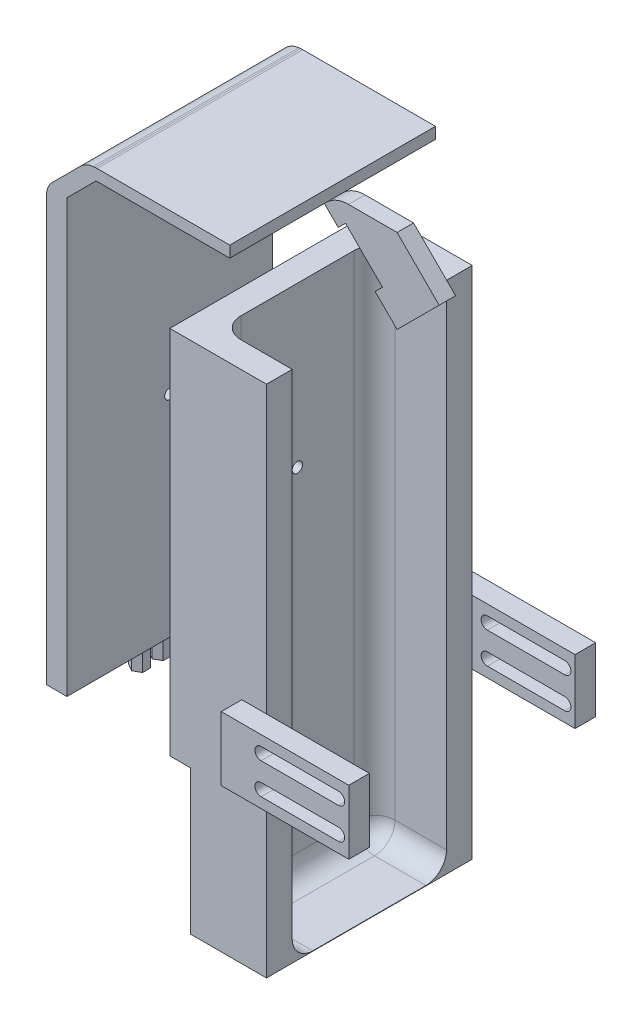
from build123d import *

# Parameters (mm, degrees)
SKETCH1_W                 = 25
SKETCH1_H                 = 100
BOSS_EXTRUDE1_DEPTH       = 250
BOSS_EXTRUDE2_DEPTH       = 30
BOSS_EXTRUDE2_DEPTH_BACK  = 250
SKETCH5_W                 = 10
SKETCH5_H                 = 100
SKETCH6_R                 = 2.5
CUT_EXTRUDE1_DEPTH        = 250
SKETCH7_W                 = 100
SKETCH7_H                 = 7.071067811
BOSS_EXTRUDE3_DEPTH       = 20
LOFT1_START               = -240.416305603
LOFT1_OUTLINE_W           = 27.071067812
LOFT1_OUTLINE_H           = 100
LOFT1_DEPTH               = 7.071067811
FILLET1_R                 = 10
SKETCH8_W                 = 100
SKETCH8_H                 = 5.5
BOSS_EXTRUDE4_DEPTH       = 65
LOFT2_START               = -301.723059561
LOFT2_OUTLINE_W           = 5.02493781
LOFT2_OUTLINE_H           = 100
LOFT2_DEPTH               = 5.472704546
FILLET2_R                 = 10
SKETCH9_W                 = 8
SKETCH9_H                 = 3.889087297
BOSS_EXTRUDE5_DEPTH       = 50
SKETCH12_W                = 8
SKETCH12_H                = 25
BOSS_EXTRUDE7_DEPTH       = 50
SKETCH11_W                = 25.4
SKETCH11_H                = 25.4
CUT_EXTRUDE4_DEPTH        = 5
CUT_EXTRUDE6_DEPTH        = 80
CUT_EXTRUDE6_DEPTH_BACK   = 10
SKETCH14_W                = 8
SKETCH14_H                = 14.927669529
SKETCH15_W                = 22
SKETCH15_H                = 250
BOSS_EXTRUDE8_DEPTH       = 100
SKETCH16_W                = 75
SKETCH16_H                = 250
CUT_EXTRUDE7_DEPTH        = 35
FILLET4_R                 = 10
SKETCH18_W                = 35
SKETCH18_H                = 0.2
BOSS_EXTRUDE10_DEPTH      = 75
FILLET5_R                 = 10
FILLET6_R                 = 15
BOSS_EXTRUDE11_DEPTH      = 10
BOSS_EXTRUDE11_DEPTH_BACK = 110
CUT_EXTRUDE8_DEPTH        = 100
SKETCH21_W                = 10
SKETCH21_H                = 70
CUT_EXTRUDE9_DEPTH        = 100
BOSS_EXTRUDE12_DEPTH      = 10
SKETCH24_W                = 10
SKETCH24_H                = 70
CUT_EXTRUDE10_DEPTH       = 100
BOSS_EXTRUDE13_DEPTH      = 10
SKETCH26_W                = 10
SKETCH26_H                = 34.88136448
SKETCH26_H_2              = 34.684301237
CUT_EXTRUDE11_DEPTH       = 10


with BuildPart() as part:
    # Sketch1 → Boss-Extrude1 (new body)
    with BuildSketch(Plane(origin=(0, 0, 0), x_dir=(1, 0, 0), z_dir=(0, 1, 0))):
        with Locations((12.5, 50)):
            Rectangle(SKETCH1_W, SKETCH1_H)
    extrude(amount=BOSS_EXTRUDE1_DEPTH)


with BuildPart() as body_2:
    # Sketch5 → Boss-Extrude2 (new, two sides: drawn at the far end of the back side and taken through both)
    with BuildSketch(Plane(origin=(0, 250, 0), x_dir=(1, 0, 0), z_dir=(0, 1, 0)).offset(-BOSS_EXTRUDE2_DEPTH_BACK)):
        with Locations((-55, 50)):
            Rectangle(SKETCH5_W, SKETCH5_H)
    extrude(amount=BOSS_EXTRUDE2_DEPTH + BOSS_EXTRUDE2_DEPTH_BACK)


with BuildPart() as cut_extrude1_tool:
    # Sketch6 → Cut-Extrude1 (new body)
    with BuildSketch(Plane.ZY.offset(60)):
        with Locations((-50, 172.5)):
            Circle(SKETCH6_R)
    extrude(amount=-CUT_EXTRUDE1_DEPTH)


with BuildPart() as part_1:
    add(part.part)

    # Cut-Extrude1: cut by cut_extrude1_tool
    add(cut_extrude1_tool.part, mode=Mode.SUBTRACT)

    # Sketch15 → Boss-Extrude8 (add)
    with BuildSketch(Plane.XY):
        with Locations((36, 125)):
            Rectangle(SKETCH15_W, SKETCH15_H)
    extrude(amount=-BOSS_EXTRUDE8_DEPTH)

    # Sketch16 → Cut-Extrude7 (cut)
    with BuildSketch(Plane(origin=(47, 0, 0), x_dir=(0, 0, -1), z_dir=(1, 0, 0))):
        with Locations((50, 125)):
            Rectangle(SKETCH16_W, SKETCH16_H)
    extrude(amount=-CUT_EXTRUDE7_DEPTH, mode=Mode.SUBTRACT)

    # Fillet4
    fillet4_edges = [part_1.edges().sort_by_distance(p)[0] for p in [
        (12, 125, -87.5),
        (12, 125, -12.5),
    ]]
    fillet(fillet4_edges, radius=FILLET4_R)

    # Sketch18 → Boss-Extrude10 (add)
    with BuildSketch(Plane.XY.offset(-87.5)):
        with Locations((29.5, 0.1)):
            Rectangle(SKETCH18_W, SKETCH18_H)
    extrude(amount=BOSS_EXTRUDE10_DEPTH)

    # Fillet5
    fillet5_edges = [part_1.edges().sort_by_distance(p)[0] for p in [
        (14.928932188, 0.2, -15.428932188),
        (34.5, 0.2, -87.5),
        (14.928932188, 0.2, -84.571067812),
        (12, 0.2, -50),
        (34.5, 0.2, -12.5),
    ]]
    fillet(fillet5_edges, radius=FILLET5_R)

    # Sketch19 → Boss-Extrude11 (add, two sides: drawn at the far end of the back side and taken through both)
    with BuildSketch(Plane.XY.offset(-BOSS_EXTRUDE11_DEPTH_BACK)):
        Polygon((35, 80), (47, 80), (97, 80), (97, 111.16), (47, 111.16), (35, 111.16), align=None)
        with BuildLine():
            ThreePointArc((54.357607687, 85), (51.357607687, 88), (54.357607687, 91))
            Line((54.357607687, 91), (92, 91))
            ThreePointArc((92, 91), (95, 88), (92, 85))
            Line((92, 85), (54.357607687, 85))
        make_face(mode=Mode.SUBTRACT)
        with BuildLine():
            Line((54.357607687, 106.16), (92, 106.16))
            ThreePointArc((92, 106.16), (95, 103.16), (92, 100.16))
            Line((92, 100.16), (54.357607687, 100.16))
            ThreePointArc((54.357607687, 100.16), (51.357607687, 103.16), (54.357607687, 106.16))
        make_face(mode=Mode.SUBTRACT)
    extrude(amount=BOSS_EXTRUDE11_DEPTH + BOSS_EXTRUDE11_DEPTH_BACK)

    # Sketch20 → Cut-Extrude8 (cut)
    with BuildSketch(Plane(origin=(0, 111.16, 0), x_dir=(1, 0, 0), z_dir=(0, 1, 0))):
        Polygon((47, 100), (97, 100), (97, 0), (47, 0), (47, 12.5), (34.5, 12.5), (34.5, 87.5), (47, 87.5), align=None)
    extrude(amount=-CUT_EXTRUDE8_DEPTH, mode=Mode.SUBTRACT)

    # Sketch21 → Cut-Extrude9 (cut)
    with BuildSketch(Plane.XY):
        with Locations((5, 35)):
            Rectangle(SKETCH21_W, SKETCH21_H)
    extrude(amount=-CUT_EXTRUDE9_DEPTH, mode=Mode.SUBTRACT)

    # Sketch23 → Boss-Extrude12 (add)
    with BuildSketch(Plane.XZ.offset(-70)):
        Polygon((4.999999926, -13.46370306), (7.999999853, -11.731652295), (7.999999853, -8.267550765), (4.999999926, -6.5355), (2, -8.267550765), (2, -11.731652295), align=None)
        Polygon((4.999999926, -16.5355), (2, -18.267550765), (2, -21.731652295), (4.999999926, -23.46370306), (7.999999853, -21.731652295), (7.999999853, -18.267550765), align=None)
        Polygon((4.999999926, -26.5355), (2, -28.267550765), (2, -31.731652295), (4.999999926, -33.46370306), (7.999999853, -31.731652295), (7.999999853, -28.267550765), align=None)
        Polygon((4.999999926, -36.5355), (2, -38.267550765), (2, -41.731652295), (4.999999926, -43.46370306), (7.999999853, -41.731652295), (7.999999853, -38.267550765), align=None)
        Polygon((4.999999926, -46.5355), (2, -48.267550765), (2, -51.731652295), (4.999999926, -53.46370306), (7.999999853, -51.731652295), (7.999999853, -48.267550765), align=None)
        Polygon((4.999999926, -56.5355), (2, -58.267550765), (2, -61.731652295), (4.999999926, -63.46370306), (7.999999853, -61.731652295), (7.999999853, -58.267550765), align=None)
        Polygon((4.999999926, -66.5355), (2, -68.267550765), (2, -71.731652295), (4.999999926, -73.46370306), (7.999999853, -71.731652295), (7.999999853, -68.267550765), align=None)
        Polygon((4.999999926, -76.5355), (2, -78.267550765), (2, -81.731652295), (4.999999926, -83.46370306), (7.999999853, -81.731652295), (7.999999853, -78.267550765), align=None)
        Polygon((4.999999926, -86.5355), (2, -88.267550765), (2, -91.731652295), (4.999999926, -93.46370306), (7.999999853, -91.731652295), (7.999999853, -88.267550765), align=None)
    extrude(amount=BOSS_EXTRUDE12_DEPTH)


with BuildPart() as body_2_1:
    add(body_2.part)

    # Cut-Extrude1: cut by cut_extrude1_tool
    add(cut_extrude1_tool.part, mode=Mode.SUBTRACT)



with BuildPart() as body_3:
    # Sketch7 → Boss-Extrude3 (new body)
    with BuildSketch(Plane(origin=(115, 115, 0), x_dir=(0, 0, -1), z_dir=(0.7071067811865464, 0.7071067811865488, 0))):
        with Locations((50, 236.880771697)):
            Rectangle(SKETCH7_W, SKETCH7_H)
    extrude(amount=BOSS_EXTRUDE3_DEPTH)


with BuildPart() as body_2_2:
    add(body_2_1.part)

    add(body_3.part)  # Loft1 merges body 3
    # Loft1: read off the stored shape, not the designer's step
    # Loft1 outline → Loft1 (add)
    with BuildSketch(Plane(origin=(0, 0, 0), x_dir=(0.707106781186545, 0.70710678118655, 0), z_dir=(0.70710678118655, -0.707106781186545, 0)).offset(LOFT1_START)):
        with Locations((169.099025767, -50)):
            Rectangle(LOFT1_OUTLINE_W, LOFT1_OUTLINE_H)
    extrude(amount=LOFT1_DEPTH)

    # Fillet1
    fillet1_edges = [body_2_2.edges().sort_by_distance(p)[0] for p in [
        (-60, 280, -50),
    ]]
    fillet(fillet1_edges, radius=FILLET1_R)



with BuildPart() as body_3_2:
    # Sketch8 → Boss-Extrude4 (new body)
    with BuildSketch(Plane(origin=(-35.857864376, 0, 0), x_dir=(0, 0, -1), z_dir=(1, 0, 0))):
        with Locations((50, 296.892135624)):
            Rectangle(SKETCH8_W, SKETCH8_H)
    extrude(amount=BOSS_EXTRUDE4_DEPTH)


with BuildPart() as body_2_3:
    add(body_2_2.part)

    add(body_3_2.part)  # Loft2 merges body 3 2
    # Loft2: read off the stored shape, not the designer's step
    # Loft2 outline → Loft2 (add)
    with BuildSketch(Plane(origin=(0, 0, 0), x_dir=(0.9950371902099893, 0.09950371902099844, 0), z_dir=(0.09950371902099843, -0.9950371902099893, 0)).offset(LOFT2_START)):
        with Locations((-8.376870651, -50)):
            Rectangle(LOFT2_OUTLINE_W, LOFT2_OUTLINE_H)
    extrude(amount=LOFT2_DEPTH)

    # Fillet2
    # the kernel refuses this fillet: 10 mm, written as the material it takes off along each edge
    with BuildSketch(Plane(origin=(-35.857864376, 299.642135624, 1.246890532), x_dir=(-0.995037190180644, -0.0995037193144514, 0), z_dir=(0, 0, -1))) as fillet2_piece_1:
        with BuildLine():
            CenterArc((FILLET2_R * 0.0498756212687, -FILLET2_R), FILLET2_R, 90.000000017, 5.710593137)
            Line((-FILLET2_R * 0.0496280980457, -FILLET2_R * 0.00496280981936), (0, 0))
            Line((0, 0), (FILLET2_R * 0.0498756209738, 0))
        make_face()
    extrude(amount=102.493781063, mode=Mode.SUBTRACT)
    with BuildSketch(Plane(origin=(-40.857864376, 299.142135624, -108.924084456), x_dir=(-0.707106781102227, -0.7071067812708679, 0), z_dir=(0, 0, 1))) as fillet2_piece_2:
        with BuildLine():
            CenterArc((FILLET2_R * 0.356963378263, FILLET2_R), FILLET2_R, 230.710593131, 39.289406863)
            Line((-FILLET2_R * 0.276274412087, FILLET2_R * 0.226042700872), (0, 0))
            Line((0, 0), (FILLET2_R * 0.356963378144, 0))
        make_face()
    extrude(amount=117.848168911, mode=Mode.SUBTRACT)

    # Sketch24 → Cut-Extrude10 (cut)
    with BuildSketch(Plane.XY):
        with Locations((-55, 35)):
            Rectangle(SKETCH24_W, SKETCH24_H)
    extrude(amount=-CUT_EXTRUDE10_DEPTH, mode=Mode.SUBTRACT)

    # Sketch25 → Boss-Extrude13 (add)
    with BuildSketch(Plane.XZ.offset(-70)):
        Polygon((-55.099108821, -14.38952175), (-51.698217642, -12.426016313), (-51.698217642, -8.499005438), (-55.099108821, -6.5355), (-58.5, -8.499005438), (-58.5, -12.426016313), align=None)
        Polygon((-55.099108821, -24.38952175), (-51.698217642, -22.426016313), (-51.698217642, -18.499005438), (-55.099108821, -16.5355), (-58.5, -18.499005438), (-58.5, -22.426016313), align=None)
        Polygon((-55.099108821, -34.38952175), (-51.698217642, -32.426016313), (-51.698217642, -28.499005438), (-55.099108821, -26.5355), (-58.5, -28.499005438), (-58.5, -32.426016313), align=None)
        Polygon((-55.099108821, -44.38952175), (-51.698217642, -42.426016313), (-51.698217642, -38.499005438), (-55.099108821, -36.5355), (-58.5, -38.499005438), (-58.5, -42.426016313), align=None)
        Polygon((-55.099108821, -54.38952175), (-51.698217642, -52.426016313), (-51.698217642, -48.499005438), (-55.099108821, -46.5355), (-58.5, -48.499005438), (-58.5, -52.426016313), align=None)
        Polygon((-55.099108821, -64.38952175), (-51.698217642, -62.426016313), (-51.698217642, -58.499005438), (-55.099108821, -56.5355), (-58.5, -58.499005438), (-58.5, -62.426016313), align=None)
        Polygon((-55.099108821, -74.38952175), (-51.698217642, -72.426016313), (-51.698217642, -68.499005438), (-55.099108821, -66.5355), (-58.5, -68.499005438), (-58.5, -72.426016313), align=None)
        Polygon((-55.099108821, -84.38952175), (-51.698217642, -82.426016313), (-51.698217642, -78.499005438), (-55.099108821, -76.5355), (-58.5, -78.499005438), (-58.5, -82.426016313), align=None)
        Polygon((-55.099108821, -94.38952175), (-51.698217642, -92.426016313), (-51.698217642, -88.499005438), (-55.099108821, -86.5355), (-58.5, -88.499005438), (-58.5, -92.426016313), align=None)
    extrude(amount=BOSS_EXTRUDE13_DEPTH)

    # Sketch26 → Cut-Extrude11 (cut)
    with BuildSketch(Plane.XZ.offset(-60)):
        with Locations((-55, -17.44068224)):
            Rectangle(SKETCH26_W, SKETCH26_H)
        with Locations((-55, -82.657849382)):
            Rectangle(SKETCH26_W, SKETCH26_H_2)
    extrude(amount=-CUT_EXTRUDE11_DEPTH, mode=Mode.SUBTRACT)


with BuildPart() as body_3_3:
    # Sketch9 → Boss-Extrude5 (new body)
    with BuildSketch(Plane(origin=(-132.5, 132.5, 0), x_dir=(0, 0, -1), z_dir=(0.7071067811865464, -0.7071067811865488, 0))):
        with Locations((50, 230.541044099)):
            Rectangle(SKETCH9_W, SKETCH9_H)
    extrude(amount=BOSS_EXTRUDE5_DEPTH)

    # Sketch12 → Boss-Extrude7 (add)
    with BuildSketch(Plane(origin=(-97.144660941, 97.144660941, 0), x_dir=(0, 0, -1), z_dir=(0.7071067811865477, -0.7071067811865475, 0))):
        with Locations((50, 244.985587747)):
            Rectangle(SKETCH12_W, SKETCH12_H)
    extrude(amount=-BOSS_EXTRUDE7_DEPTH)

    # Sketch11 → Cut-Extrude4 (cut)
    with BuildSketch(Plane(origin=(161.642135624, 161.642135624, 0), x_dir=(0, 0, 1), z_dir=(-0.7071067811865487, -0.7071067811865465, 0))):
        with Locations((-50, 165.148767049)):
            Rectangle(SKETCH11_W, SKETCH11_H)
    extrude(amount=-CUT_EXTRUDE4_DEPTH, mode=Mode.SUBTRACT)

    # Sketch14 → Cut-Extrude6 (cut, two sides: drawn at the far end of the back side and taken through both)
    with BuildSketch(Plane(origin=(35, 0, 0), x_dir=(0, 0, -1), z_dir=(1, 0, 0)).offset(-CUT_EXTRUDE6_DEPTH_BACK)):
        with Locations((50, 307.105970388)):
            Rectangle(SKETCH14_W, SKETCH14_H)
    extrude(amount=CUT_EXTRUDE6_DEPTH + CUT_EXTRUDE6_DEPTH_BACK, mode=Mode.SUBTRACT)

    # Fillet6
    fillet6_edges = [body_3_3.edges().sort_by_distance(p)[0] for p in [
        (34.642135624, 299.642135624, -50),
    ]]
    fillet(fillet6_edges, radius=FILLET6_R)


solid = Compound([part_1.part, body_2_3.part, body_3_3.part])
